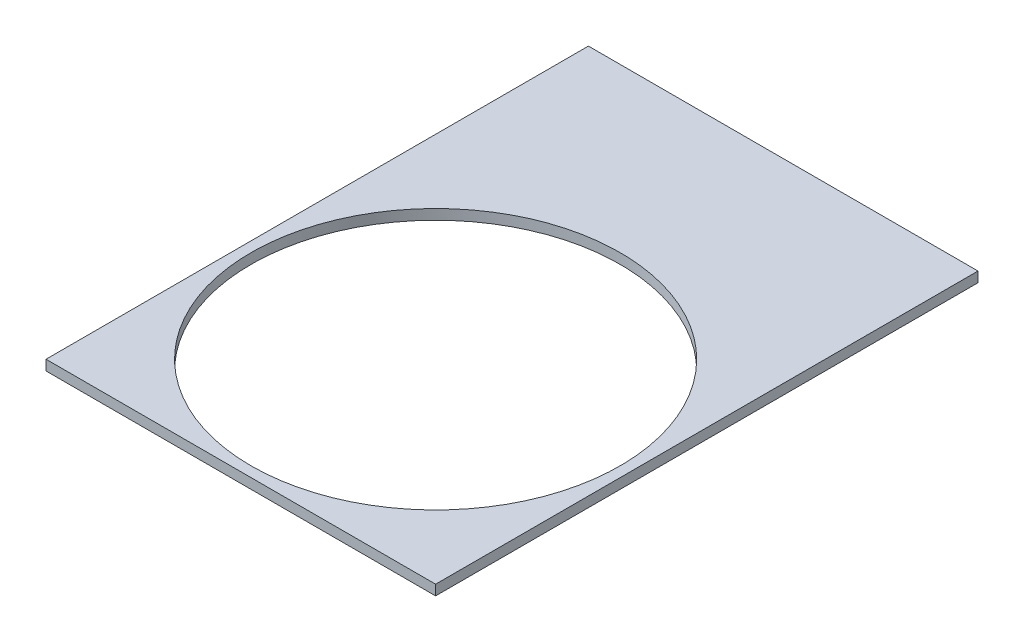
from build123d import *

# Parameters (mm, degrees)
SKETCH1_W           = 242.8875
SKETCH1_H           = 338.1375
SKETCH1_R           = 115.09375
BOSS_EXTRUDE1_DEPTH = 6.35


with BuildPart() as part:
    # Sketch1 → Boss-Extrude1 (new body)
    with BuildSketch(Plane(origin=(0, 0, 0), x_dir=(1, 0, 0), z_dir=(0, 1, 0))):
        with Locations((235.940705356, 205.764388046)):
            Rectangle(SKETCH1_W, SKETCH1_H)
        with Locations((235.940705356, 158.139388046)):
            Circle(SKETCH1_R, mode=Mode.SUBTRACT)
    extrude(amount=BOSS_EXTRUDE1_DEPTH)


solid = part.part
